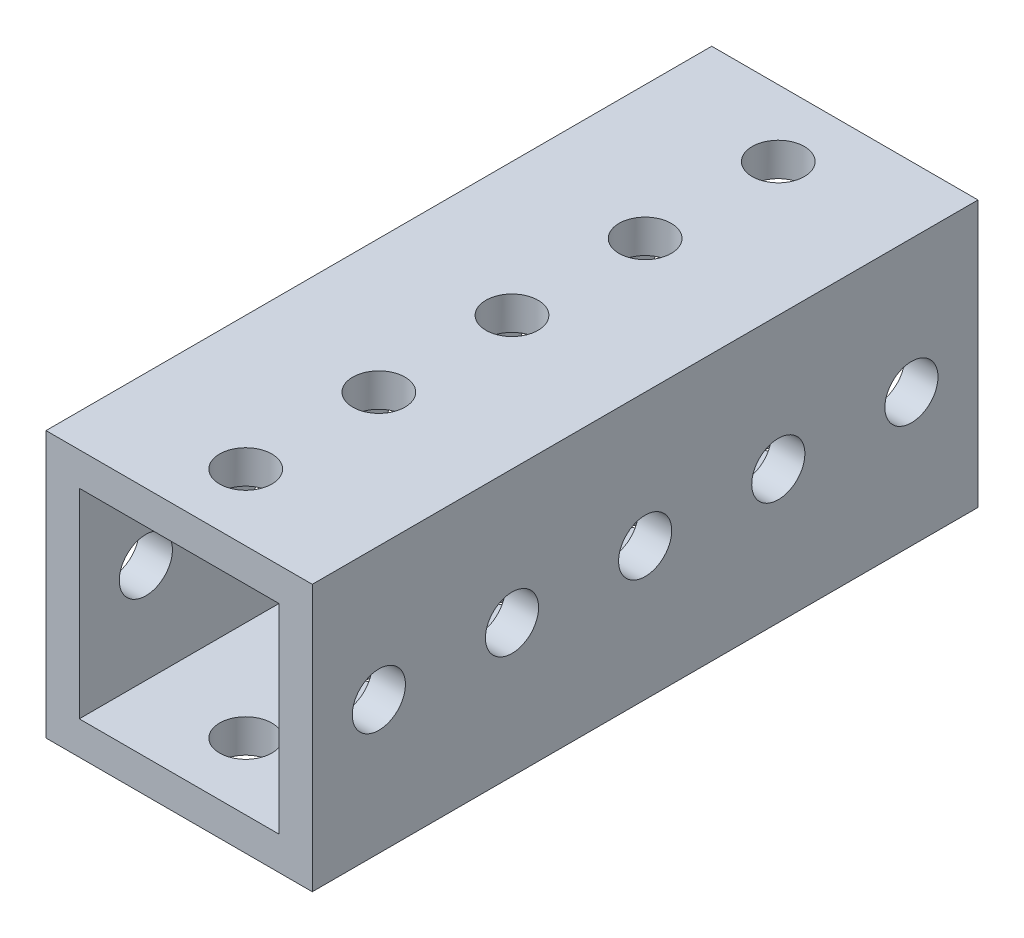
from build123d import *

# Parameters (mm, degrees)
SKETCH1_W           = 25.4
SKETCH1_H           = 25.4
BOSS_EXTRUDE1_DEPTH = 63.5
SHELL1_T            = -3.175
SKETCH2_R           = 2.4892
CUT_EXTRUDE1_DEPTH  = 63.5
SKETCH3_R           = 2.53492
CUT_EXTRUDE2_DEPTH  = 63.5


with BuildPart() as part:
    # Sketch1 → Boss-Extrude1 (new body)
    with BuildSketch(Plane.XY):
        with Locations((12.7, 12.7)):
            Rectangle(SKETCH1_W, SKETCH1_H)
    extrude(amount=BOSS_EXTRUDE1_DEPTH)

    # Shell1
    shell1_openings = [part.faces().sort_by_distance(p)[0] for p in [
        (12.7, 12.7, 0),
        (12.7, 12.7, 63.5),
    ]]
    offset(amount=SHELL1_T, openings=shell1_openings, kind=Kind.INTERSECTION)

    # Sketch2 → Cut-Extrude1 (cut)
    with BuildSketch(Plane(origin=(0, 25.4, 0), x_dir=(1, 0, 0), z_dir=(0, 1, 0))):
        with Locations((12.7, -6.35)):
            Circle(SKETCH2_R)
        with Locations((12.7, -19.05)):
            Circle(SKETCH2_R)
        with Locations((12.7, -31.75)):
            Circle(SKETCH2_R)
        with Locations((12.7, -44.45)):
            Circle(SKETCH2_R)
        with Locations((12.7, -57.15)):
            Circle(SKETCH2_R)
    extrude(amount=-CUT_EXTRUDE1_DEPTH, mode=Mode.SUBTRACT)

    # Sketch3 → Cut-Extrude2 (cut)
    with BuildSketch(Plane(origin=(25.4, 0, 0), x_dir=(0, 0, -1), z_dir=(1, 0, 0))):
        with Locations((-57.15, 12.7)):
            Circle(SKETCH3_R)
        with Locations((-44.45, 12.7)):
            Circle(SKETCH3_R)
        with Locations((-31.75, 12.7)):
            Circle(SKETCH3_R)
        with Locations((-19.05, 12.7)):
            Circle(SKETCH3_R)
        with Locations((-6.35, 12.7)):
            Circle(SKETCH3_R)
    extrude(amount=-CUT_EXTRUDE2_DEPTH, mode=Mode.SUBTRACT)


solid = part.part
